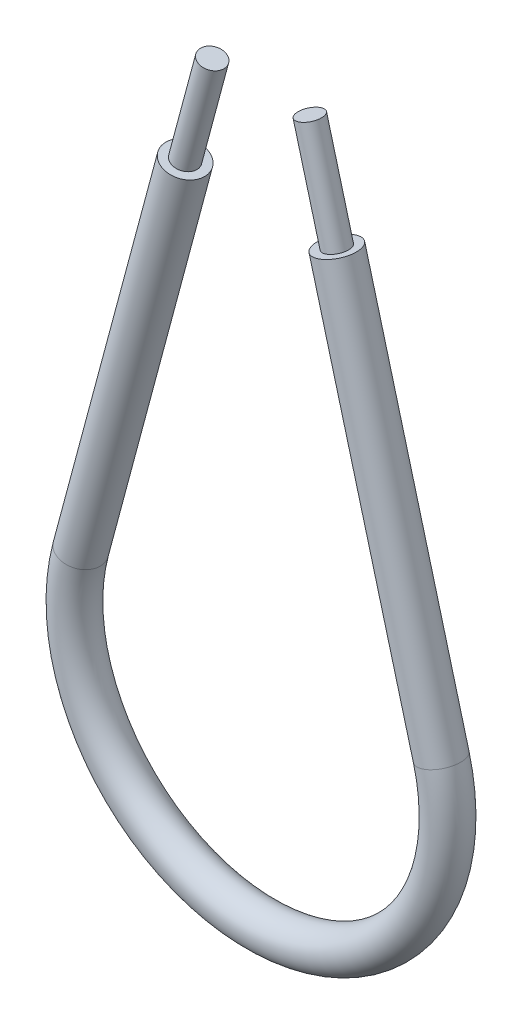
from build123d import *

# Parameters (mm, degrees)
SKETCH3_R   = 2.38125
SKETCH4_R   = 3.96875
SKETCH4_R_2 = 2.38125


with BuildPart() as part:
    # Sweep1: sweep along a path in Sketch2
    with BuildLine(Plane.XY) as sweep1_path:
        Line((-114.365151202, 4.504376727), (-88.389976761, -92.436294023))
        ThreePointArc((-88.389976761, -92.436294023), (-124.004465969, -138.85), (-159.618955177, -92.436294023))
        Line((-159.618955177, -92.436294023), (-133.643780736, 4.504376727))
    # Sketch3 → Sweep1 (sweep)
    with BuildSketch(Plane(origin=(-114.365151202, 4.504376727, 0), x_dir=(-0.96592582628907, -0.25881904510251486, 0), z_dir=(0.25881904510251486, -0.96592582628907, 0))):
        Circle(SKETCH3_R)
    sweep(path=sweep1_path.line)


with BuildPart() as body_2:
    # Sweep2: sweep along a path in Sketch5
    with BuildLine(Plane.XY) as sweep2_path:
        Line((-138.985158779, -15.429917513), (-159.618955177, -92.436294023))
        ThreePointArc((-159.618955177, -92.436294023), (-124.004465969, -138.85), (-88.389976761, -92.436294023))
        Line((-88.389976761, -92.436294023), (-109.023773159, -15.429917513))
    # Sketch4 → Sweep2 (sweep)
    with BuildSketch(Plane(origin=(-3.445728615, 12.859634261, 0), x_dir=(0.96592582628907, 0.25881904510251463, 0), z_dir=(0.2588190451025146, -0.9659258262890699, 0))):
        with Locations((-109.302434691, 0)):
            Circle(SKETCH4_R)
        with Locations((-109.302434691, 0)):
            Circle(SKETCH4_R_2, mode=Mode.SUBTRACT)
    sweep(path=sweep2_path.line)


solid = Compound([part.part, body_2.part])
